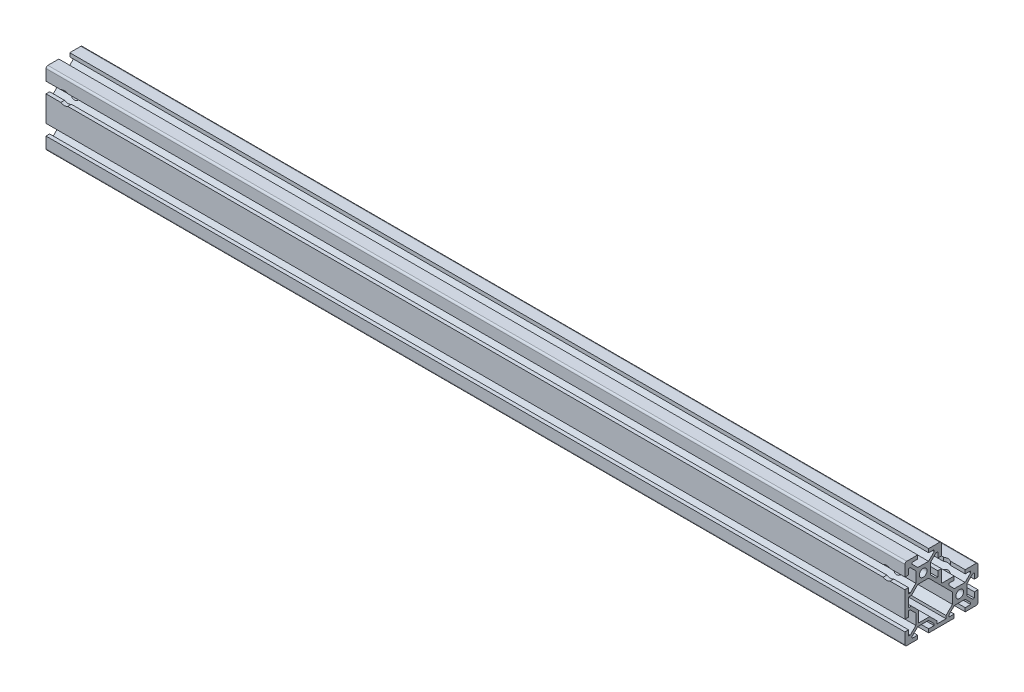
from build123d import *

# Parameters (mm, degrees)
SKETCH1_R           = 2.1
BOSS_EXTRUDE1_DEPTH = 470
SKETCH88_R          = 3.55
CUT_EXTRUDE61_DEPTH = 20
SKETCH89_R          = 3.55
CUT_EXTRUDE62_DEPTH = 20


with BuildPart() as part:
    # Sketch1 → Boss-Extrude1 (new body)
    with BuildSketch(Plane(origin=(0, 0, 0), x_dir=(0, 0, -1), z_dir=(1, 0, 0))):
        with BuildLine():
            Line((-13, 18), (-13, 20))
            Line((-13, 20), (-19, 20))
            ThreePointArc((-19, 20), (-19.707106781, 19.707106781), (-20, 19))
            Line((-20, 19), (-20, 13))
            Line((-20, 13), (-18, 13))
            Line((-18, 13), (-18, 16))
            Line((-18, 16), (-17.060660172, 16))
            Line((-17.060660172, 16), (-14, 12.939339828))
            Line((-14, 12.939339828), (-14, 7.060660172))
            Line((-14, 7.060660172), (-17.060660172, 4))
            Line((-17.060660172, 4), (-18, 4))
            Line((-18, 4), (-18, 7))
            Line((-18, 7), (-20, 7))
            Line((-20, 7), (-20, -7))
            Line((-20, -7), (-18, -7))
            Line((-18, -7), (-18, -4))
            Line((-18, -4), (-17.060660172, -4))
            Line((-17.060660172, -4), (-14, -7.060660172))
            Line((-14, -7.060660172), (-14, -12.939339828))
            Line((-14, -12.939339828), (-17.060660172, -16))
            Line((-17.060660172, -16), (-18, -16))
            Line((-18, -16), (-18, -13))
            Line((-18, -13), (-20, -13))
            Line((-20, -13), (-20, -19))
            ThreePointArc((-20, -19), (-19.707106781, -19.707106781), (-19, -20))
            Line((-19, -20), (-13, -20))
            Line((-13, -20), (-13, -18))
            Line((-13, -18), (-16, -18))
            Line((-16, -18), (-16, -17.060660172))
            Line((-16, -17.060660172), (-12.939339828, -14))
            Line((-12.939339828, -14), (-7.060660172, -14))
            Line((-7.060660172, -14), (-4, -17.060660172))
            Line((-4, -17.060660172), (-4, -18))
            Line((-4, -18), (-7, -18))
            Line((-7, -18), (-7, -20))
            Line((-7, -20), (7, -20))
            Line((7, -20), (7, -18))
            Line((7, -18), (4, -18))
            Line((4, -18), (4, -17.060660172))
            Line((4, -17.060660172), (7.060660172, -14))
            Line((7.060660172, -14), (12.939339828, -14))
            Line((12.939339828, -14), (16, -17.060660172))
            Line((16, -17.060660172), (16, -18))
            Line((16, -18), (13, -18))
            Line((13, -18), (13, -20))
            Line((13, -20), (19, -20))
            ThreePointArc((19, -20), (19.707106781, -19.707106781), (20, -19))
            Line((20, -19), (20, -13))
            Line((20, -13), (18, -13))
            Line((18, -13), (18, -16))
            Line((18, -16), (17.060660172, -16))
            Line((17.060660172, -16), (14, -12.939339828))
            Line((14, -12.939339828), (14, -7.060660172))
            Line((14, -7.060660172), (17.060660172, -4))
            Line((17.060660172, -4), (18, -4))
            Line((18, -4), (18, -7))
            Line((18, -7), (20, -7))
            Line((20, -7), (20, -1))
            ThreePointArc((20, -1), (19.707106781, -0.292893219), (19, 0))
            Line((19, 0), (13, 0))
            Line((13, 0), (13, -2))
            Line((13, -2), (16, -2))
            Line((16, -2), (16, -2.939339828))
            Line((16, -2.939339828), (12.939339828, -6))
            Line((12.939339828, -6), (7.060660172, -6))
            Line((7.060660172, -6), (4, -2.939339828))
            Line((4, -2.939339828), (4, -2))
            Line((4, -2), (7, -2))
            Line((7, -2), (7, 0))
            Line((7, 0), (0.3, 0))
            ThreePointArc((0.3, 0), (0.087867966, 0.087867966), (0, 0.3))
            Line((0, 0.3), (0, 7))
            Line((0, 7), (-2, 7))
            Line((-2, 7), (-2, 4))
            Line((-2, 4), (-2.939339828, 4))
            Line((-2.939339828, 4), (-6, 7.060660172))
            Line((-6, 7.060660172), (-6, 12.939339828))
            Line((-6, 12.939339828), (-2.939339828, 16))
            Line((-2.939339828, 16), (-2, 16))
            Line((-2, 16), (-2, 13))
            Line((-2, 13), (0, 13))
            Line((0, 13), (0, 19))
            ThreePointArc((0, 19), (-0.292893219, 19.707106781), (-1, 20))
            Line((-1, 20), (-7, 20))
            Line((-7, 20), (-7, 18))
            Line((-7, 18), (-4, 18))
            Line((-4, 18), (-4, 17.060660172))
            Line((-4, 17.060660172), (-7.060660172, 14))
            Line((-7.060660172, 14), (-12.939339828, 14))
            Line((-12.939339828, 14), (-16, 17.060660172))
            Line((-16, 17.060660172), (-16, 18))
            Line((-16, 18), (-13, 18))
        make_face()
        with Locations((10, -10)):
            Circle(SKETCH1_R, mode=Mode.SUBTRACT)
        with Locations((-10, 10)):
            Circle(SKETCH1_R, mode=Mode.SUBTRACT)
        Polygon((6, -7.060660172), (-7.060660172, 6), (-12.939339828, 6), (-16.439339828, 2.5), (-18, 2.5), (-18, -2.5), (-16.439339828, -2.5), (-12.5, -6.439339828), (-12.5, -12.5), (-6.439339828, -12.5), (-2.5, -16.439339828), (-2.5, -18), (2.5, -18), (2.5, -16.439339828), (6, -12.939339828), align=None, mode=Mode.SUBTRACT)
    extrude(amount=BOSS_EXTRUDE1_DEPTH)

    # Sketch88 → Cut-Extrude61 (cut)
    with BuildSketch(Plane.XZ.offset(20)):
        with Locations((10, -10)):
            Circle(SKETCH88_R)
    cut_extrude61 = extrude(amount=-CUT_EXTRUDE61_DEPTH, mode=Mode.SUBTRACT)

    # Sketch89 → Cut-Extrude62 (cut)
    with BuildSketch(Plane.XY.offset(20)):
        with Locations((10, 10)):
            Circle(SKETCH89_R)
    cut_extrude62 = extrude(amount=-CUT_EXTRUDE62_DEPTH, mode=Mode.SUBTRACT)

    # Mirror1: Cut-Extrude61, Cut-Extrude62 across plane
    add(cut_extrude61.mirror(Plane.ZY.offset(-235)), mode=Mode.SUBTRACT)
    add(cut_extrude62.mirror(Plane.ZY.offset(-235)), mode=Mode.SUBTRACT)


solid = part.part
